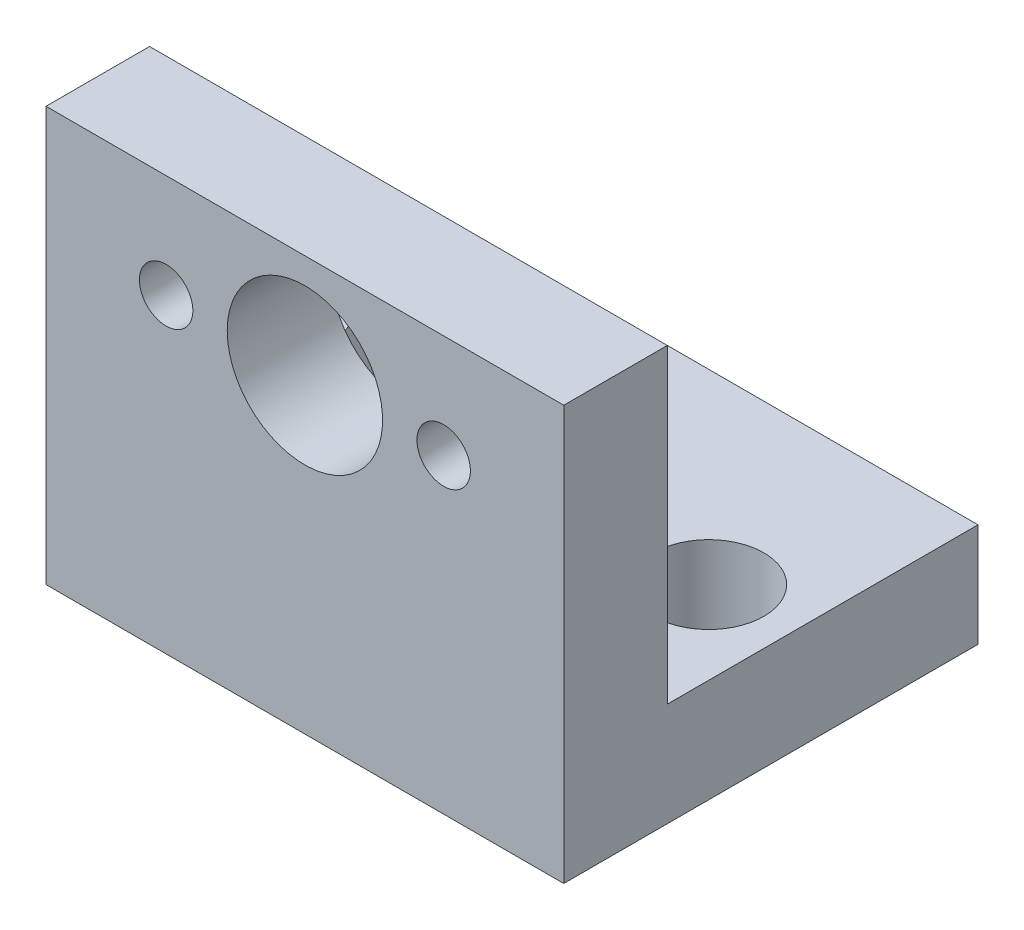
from build123d import *

# Parameters (mm, degrees)
BOSS_EXTRUDE1_DEPTH = 31.75
SKETCH3_R           = 4.7625
SKETCH3_R_2         = 1.6383
CUT_EXTRUDE1_DEPTH  = 45.901280605
SKETCH4_R           = 3.3782
CUT_EXTRUDE2_DEPTH  = 45.901280605


with BuildPart() as part:
    # Sketch2 → Boss-Extrude1 (new body)
    with BuildSketch(Plane(origin=(0, 0, 0), x_dir=(0, 0, -1), z_dir=(1, 0, 0))):
        Polygon((0, 0), (25.4, 0), (25.4, 6.35), (6.35, 6.35), (6.35, 25.4), (0, 25.4), align=None)
    extrude(amount=BOSS_EXTRUDE1_DEPTH)

    # Sketch3 → Cut-Extrude1 (cut, through all)
    with BuildSketch(Plane(origin=(0, 0, -6.35), x_dir=(-1, 0, 0), z_dir=(0, 0, -1))):
        with Locations((-15.875, 19.05)):
            Circle(SKETCH3_R)
        with Locations((-7.366, 19.05)):
            Circle(SKETCH3_R_2)
        with Locations((-24.384, 19.05)):
            Circle(SKETCH3_R_2)
    extrude(amount=-CUT_EXTRUDE1_DEPTH, mode=Mode.SUBTRACT)

    # Sketch4 → Cut-Extrude2 (cut, through all)
    with BuildSketch(Plane(origin=(0, 6.35, 0), x_dir=(1, 0, 0), z_dir=(0, 1, 0))):
        with Locations((5.08, 17.78)):
            Circle(SKETCH4_R)
        with Locations((26.67, 13.97)):
            Circle(SKETCH4_R)
    extrude(amount=-CUT_EXTRUDE2_DEPTH, mode=Mode.SUBTRACT)


solid = part.part
